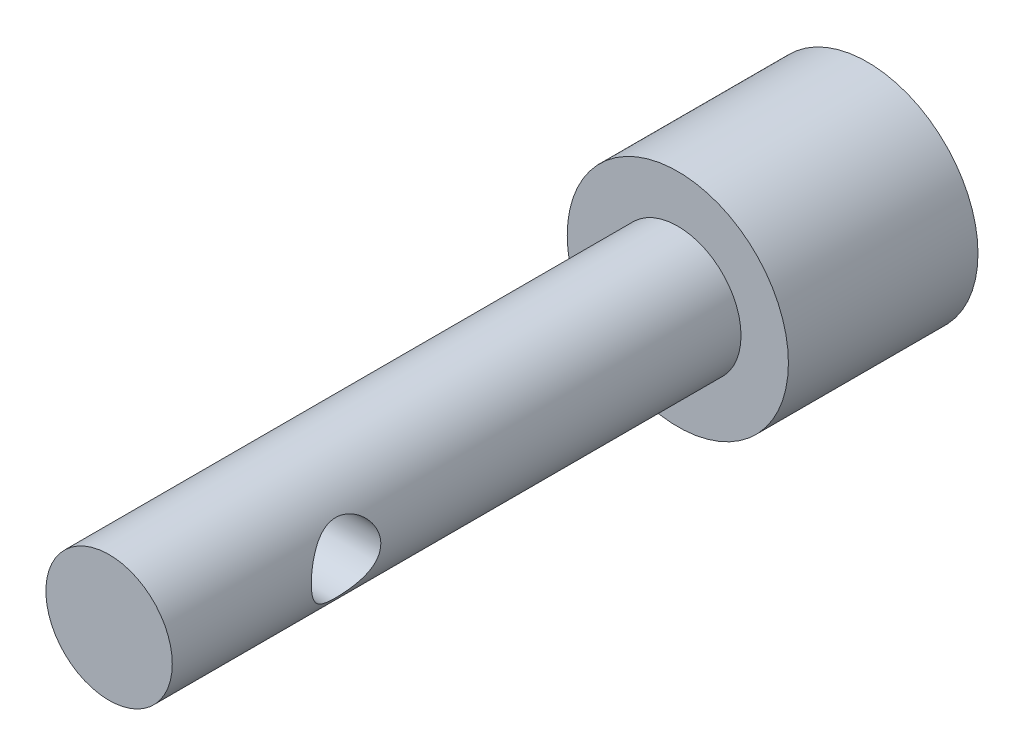
from build123d import *

# Parameters (mm, degrees)
SZKIC1_R                    = 3.5
DODANIE_WYCI_GNI_CIE1_DEPTH = 6
SZKIC2_R                    = 2
DODANIE_WYCI_GNI_CIE2_DEPTH = 18
SZKIC3_R                    = 1.1
WYTNIJ_WYCI_GNI_CIE1_DEPTH  = 25.869660231
SZKIC4_R                    = 2.3
WYTNIJ_WYCI_GNI_CIE2_DEPTH  = 3


with BuildPart() as part:
    # Szkic1 → Dodanie-wyciągnięcie1 (new body)
    with BuildSketch(Plane.XY):
        Circle(SZKIC1_R)
    extrude(amount=DODANIE_WYCI_GNI_CIE1_DEPTH)

    # Szkic2 → Dodanie-wyciągnięcie2 (add)
    with BuildSketch(Plane.XY.offset(6)):
        Circle(SZKIC2_R)
    extrude(amount=DODANIE_WYCI_GNI_CIE2_DEPTH)

    # Szkic3 → Wytnij-wyciągnięcie1 (cut, through all)
    with BuildSketch(Plane.ZY.offset(2)):
        with Locations((18.5, 0)):
            Circle(SZKIC3_R)
    extrude(amount=-WYTNIJ_WYCI_GNI_CIE1_DEPTH, mode=Mode.SUBTRACT)

    # Szkic4 → Wytnij-wyciągnięcie2 (cut)
    with BuildSketch(Plane(origin=(0, 0, 0), x_dir=(-1, 0, 0), z_dir=(0, 0, -1))):
        Circle(SZKIC4_R)
    extrude(amount=-WYTNIJ_WYCI_GNI_CIE2_DEPTH, mode=Mode.SUBTRACT)


solid = part.part
